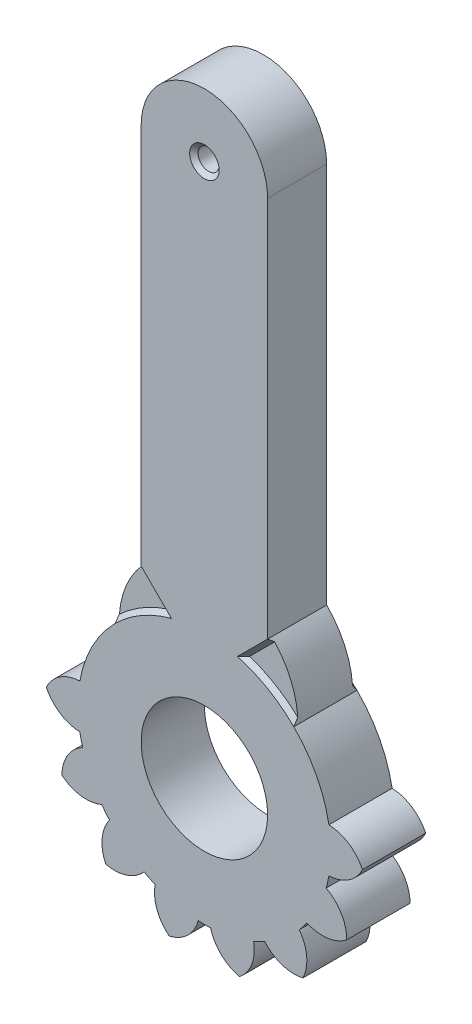
from build123d import *

# Parameters (mm, degrees)
SKETCH2_R           = 30
SKETCH2_R_2         = 15
BOSS_EXTRUDE1_DEPTH = 7.5
BOSS_EXTRUDE2_DEPTH = 6.5
CHAMFER2_SIZE       = 1
BOSS_EXTRUDE3_DEPTH = 14
CHAMFER3_SIZE       = 1
SKETCH6_R           = 2.5
CUT_EXTRUDE1_DEPTH  = 14
CHAMFER4_SIZE       = 1
CHAMFER5_SIZE       = 1
BOSS_EXTRUDE4_DEPTH = 15


# Some blends are built 0.0001 mm under size
with BuildPart() as part:
    # Sketch2 → Boss-Extrude1 (new, symmetric)
    with BuildSketch(Plane.XY):
        Circle(SKETCH2_R)
        Circle(SKETCH2_R_2, mode=Mode.SUBTRACT)
    extrude(amount=BOSS_EXTRUDE1_DEPTH, both=True)

    # Sketch4 → Boss-Extrude2 (add, symmetric)
    with BuildSketch(Plane.XY):
        with BuildLine():
            ThreePointArc((-21.213203436, 21.213203436), (0, 42.343834222), (21.213203436, 21.213203436))
            ThreePointArc((21.213203436, 21.213203436), (0, 30), (-21.213203436, 21.213203436))
        make_face()
    extrude(amount=BOSS_EXTRUDE2_DEPTH, both=True)

    # Chamfer2
    chamfer2_edges = [part.edges().sort_by_distance(p)[0] for p in [
        (0, 30, -6.5),
        (0, 30, 6.5),
    ]]
    chamfer(chamfer2_edges, length=CHAMFER2_SIZE - 0.0001)  # a hair under: the kernel refuses the full size

    # Sketch5 → Boss-Extrude3 (add)
    with BuildSketch(Plane(origin=(0, 0, -6.5), x_dir=(-1, 0, 0), z_dir=(0, 0, -1))):
        with BuildLine():
            Line((0, 21.130469451), (-15.000114081, 36.130583532))
            Line((-15.000114081, 36.130583532), (-15.000114081, 126.716493473))
            ThreePointArc((-15.000114081, 126.716493473), (0, 141.716607555), (15.000114081, 126.716493473))
            Line((15.000114081, 126.716493473), (15.000114081, 36.130583532))
            Line((15.000114081, 36.130583532), (0, 21.130469451))
        make_face()
    extrude(amount=-BOSS_EXTRUDE3_DEPTH)

    # Chamfer3
    # the kernel refuses this chamfer: 1 mm, written as the material it adds along each edge
    with BuildSketch(Plane(origin=(6.82237013, 27.952839581, 6.5), x_dir=(0.7068394360706772, -0.7068394360706699, -0.02749587661058651), z_dir=(0.7071067811865439, 0.7071067811865512, 0))) as chamfer3_piece_1_section:
        Polygon((CHAMFER3_SIZE * 0.999621916911, -CHAMFER3_SIZE * 0.0274958766106), (-CHAMFER3_SIZE * 0.0274958766106, -CHAMFER3_SIZE * 0.999621916911), (0, 0), align=None)
    chamfer3_piece_1 = extrude(amount=14.136759393, mode=Mode.PRIVATE)
    chamfer3_piece_1 = chamfer3_piece_1 & Plane(origin=(0, 21.130469451, 6.845303942), x_dir=(-0.9999923946286841, 0.003900087792649399, 0), z_dir=(0, 0, 1)) * Cylinder(21.213364771, 33, mode=Mode.PRIVATE)
    add(chamfer3_piece_1)
    with BuildSketch(Plane(origin=(-16.818568561, 37.949038012, 6.5), x_dir=(0.019442520806013823, 0.019442520806013757, 0.9996219169112968), z_dir=(0.7071067811865464, -0.7071067811865487, 0))) as chamfer3_piece_2_section:
        Polygon((CHAMFER3_SIZE * 0.999621916911, CHAMFER3_SIZE * 0.0274958766106), (-CHAMFER3_SIZE * 0.0274958766106, CHAMFER3_SIZE * 0.999621916911), (0, 0), align=None)
    chamfer3_piece_2 = extrude(amount=14.136759393, mode=Mode.PRIVATE)
    chamfer3_piece_2 = chamfer3_piece_2 & Plane(origin=(0, 21.130469451, 6.750596564), x_dir=(-0.9999923946286841, 0.003900087792649399, 0), z_dir=(0, 0, 1)) * Cylinder(21.213364771, 33, mode=Mode.PRIVATE)
    add(chamfer3_piece_2)

    # Sketch6 → Cut-Extrude1 (cut)
    with BuildSketch(Plane.XY.offset(7.5)):
        with Locations((0, 126.716493473)):
            Circle(SKETCH6_R)
    extrude(amount=-CUT_EXTRUDE1_DEPTH, mode=Mode.SUBTRACT)

    # Chamfer4
    chamfer4_edges = [part.edges().sort_by_distance(p)[0] for p in [
        (-2.5, 126.716493473, 7.5),
    ]]
    chamfer(chamfer4_edges, length=CHAMFER4_SIZE)

    # Chamfer5
    chamfer5_edges = [part.edges().sort_by_distance(p)[0] for p in [
        (-2.5, 126.716493473, -6.5),
    ]]
    chamfer(chamfer5_edges, length=CHAMFER5_SIZE)

    # Sketch7 → Boss-Extrude4 (add)
    with BuildSketch(Plane.XY.offset(7.5)):
        with BuildLine():
            ThreePointArc((-29.538927614, 5.23944228), (-34.249735627, 3.72933291), (-37.5, 0))
            ThreePointArc((-37.5, 0), (-34.249735627, -3.72933291), (-29.538927614, -5.23944228))
            ThreePointArc((-29.538927614, -5.23944228), (-30, 0), (-29.538927614, 5.23944228))
        make_face()
        with BuildLine():
            ThreePointArc((-28.886962979, -8.095885983), (-32.476042442, -11.500390508), (-33.786332546, -16.270640217))
            ThreePointArc((-33.786332546, -16.270640217), (-29.239848627, -18.220416208), (-24.340345364, -17.537034743))
            ThreePointArc((-24.340345364, -17.537034743), (-27.029066037, -13.016512174), (-28.886962979, -8.095885983))
        make_face()
        with BuildLine():
            ThreePointArc((-22.513581051, -19.827724738), (-24.270070758, -24.452320542), (-23.38086757, -29.318680593))
            ThreePointArc((-23.38086757, -29.318680593), (-18.438651002, -29.102722617), (-14.3208592, -26.361202396))
            ThreePointArc((-14.3208592, -26.361202396), (-18.704694056, -23.454944474), (-22.513581051, -19.827724738))
        make_face()
        with BuildLine():
            ThreePointArc((-11.681108284, -27.632439437), (-11.257113908, -32.561168606), (-8.344535023, -36.559796707))
            ThreePointArc((-8.344535023, -36.559796707), (-3.985452411, -34.22087789), (-1.464951237, -29.964210617))
            ThreePointArc((-1.464951237, -29.964210617), (-6.675628019, -29.247837365), (-11.681108284, -27.632439437))
        make_face()
        with BuildLine():
            ThreePointArc((1.464951237, -29.964210617), (3.985452411, -34.22087789), (8.344535023, -36.559796707))
            ThreePointArc((8.344535023, -36.559796707), (11.257113908, -32.561168606), (11.681108284, -27.632439437))
            ThreePointArc((11.681108284, -27.632439437), (6.675628019, -29.247837365), (1.464951237, -29.964210617))
        make_face()
        with BuildLine():
            ThreePointArc((14.3208592, -26.361202396), (18.438651002, -29.102722617), (23.38086757, -29.318680593))
            ThreePointArc((23.38086757, -29.318680593), (24.270070758, -24.452320542), (22.513581051, -19.827724738))
            ThreePointArc((22.513581051, -19.827724738), (18.704694056, -23.454944474), (14.3208592, -26.361202396))
        make_face()
        with BuildLine():
            ThreePointArc((33.786332546, -16.270640217), (32.476042442, -11.500390508), (28.886962979, -8.095885983))
            ThreePointArc((28.886962979, -8.095885983), (27.029066037, -13.016512174), (24.340345364, -17.537034743))
            ThreePointArc((24.340345364, -17.537034743), (29.239848627, -18.220416208), (33.786332546, -16.270640217))
        make_face()
        with BuildLine():
            ThreePointArc((29.538927614, 5.23944228), (29.884509603, 2.629845202), (30, 0))
            ThreePointArc((30, 0), (29.884509603, -2.629845202), (29.538927614, -5.23944228))
            ThreePointArc((29.538927614, -5.23944228), (34.249735627, -3.72933291), (37.5, 0))
            ThreePointArc((37.5, 0), (34.249735627, 3.72933291), (29.538927614, 5.23944228))
        make_face()
    extrude(amount=-BOSS_EXTRUDE4_DEPTH)


solid = part.part
